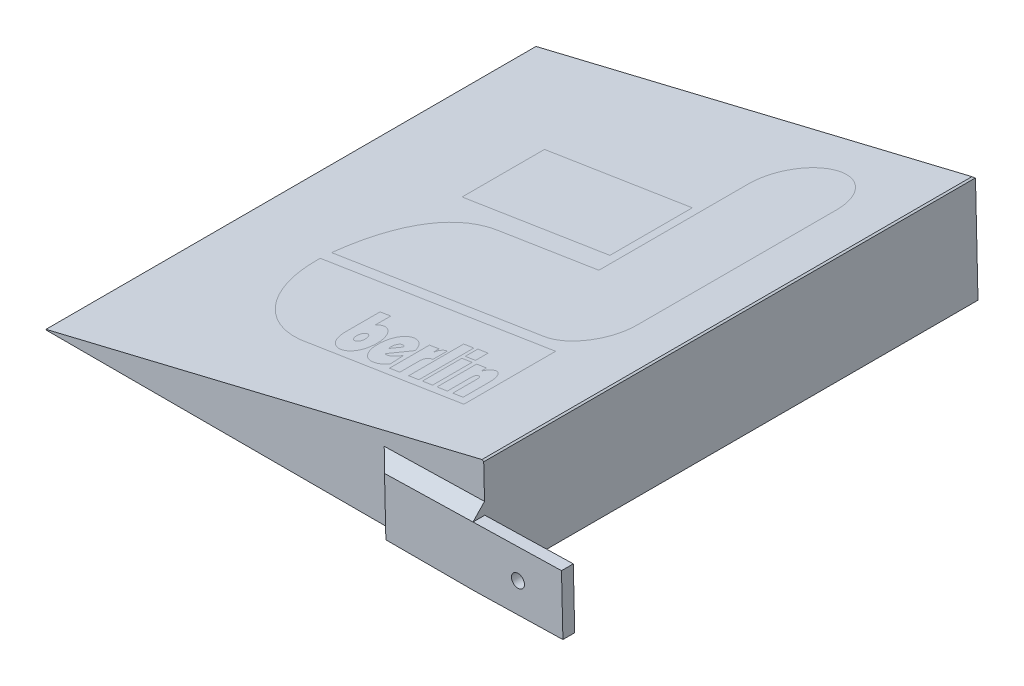
from build123d import *
from OCP.BRepFilletAPI import BRepFilletAPI_MakeChamfer

# Parameters (mm, degrees)
BOSS_EXTRUDE1_DEPTH   = 166.66666666666666
CUT_EXTRUDE1_DEPTH    = 160.666666667
BOSS_EXTRUDE2_DEPTH   = 4
SKETCH9_R             = 2.1999999999999833
CUT_EXTRUDE3_DEPTH    = 673.8557295952264
SKETCH10_R            = 2.1999999999999833
CUT_EXTRUDE4_DEPTH    = 3
CHAMFER3_SIZE         = 0.6
CHAMFER3_SIZE2        = 0.5047874406768073
CHAMFER4_SIZE         = 1
CHAMFER4_SIZE2        = 0.8287182147663876
CUT_EXTRUDE5_DEPTH    = 0.6
BOSS_EXTRUDE4_DEPTH   = 0.6
BOSS_EXTRUDE4_2_DEPTH = 0.6
BOSS_EXTRUDE4_3_DEPTH = 0.6
BOSS_EXTRUDE4_4_DEPTH = 0.6
BOSS_EXTRUDE4_5_DEPTH = 0.6
CHAMFER8_SIZE         = 4
CHAMFER9_SIZE         = 4


with BuildPart() as part:
    # Sketch4 → Boss-Extrude1 (new body)
    with BuildSketch(Plane.XY):
        Polygon((-500.7204776760873, 35.989612544106855), (-649.8557297792629, -1.837e-14), (-499.8557297792629, -6.121e-14), align=None)
    extrude(amount=-BOSS_EXTRUDE1_DEPTH)

    # Sketch6 → Cut-Extrude1 (cut)
    with BuildSketch(Plane.XY.offset(-3)):
        Polygon((-504.85717289786834, -1.837e-14), (-505.570212772658, 29.675734299461347), (-585.1090138943516, 10.481274275937695), (-584.8571728978683, -1.837e-14), align=None)
    extrude(amount=-CUT_EXTRUDE1_DEPTH, mode=Mode.SUBTRACT)

    # Sketch8 → Boss-Extrude2 (add)
    with BuildSketch(Plane.XY):
        Polygon((-500.3361452774986, 19.994229191170454), (-470.34480149074295, 20.714852438524037), (-469.86438599250715, 0.720623247353527), (-499.8557297792629, -6.121e-14), (-529.8643884908956, -2.204e-14), (-530.3274890642546, 19.273605943816776), align=None)
    extrude(amount=BOSS_EXTRUDE2_DEPTH)

    # Sketch9 → Cut-Extrude3 (cut, through all)
    with BuildSketch(Plane.XY.offset(4)):
        with Locations((-485.1002656350029, 10.357426219261987)):
            Circle(SKETCH9_R)
    extrude(amount=-CUT_EXTRUDE3_DEPTH, mode=Mode.SUBTRACT)

    # Sketch10 → Cut-Extrude4 (cut)
    with BuildSketch(Plane(origin=(0, 0, -166.66666666666666), x_dir=(-1, 0, 0), z_dir=(0, 0, -1))):
        with Locations((513.1478143821638, 11.99999999999998)):
            Circle(SKETCH10_R)
        with Locations((527.1478143821638, 11.99999999999998)):
            Circle(SKETCH10_R)
    extrude(amount=-CUT_EXTRUDE4_DEPTH, mode=Mode.SUBTRACT)

    # Chamfer3: one chamfer whose edges measure the first distance from different faces: ONE call of the kernel's chamfer builder (chamfer() names one face for all edges)
    chamfer3_edges_1 = [part.edges().sort_by_distance(p)[0] for p in [
        (-500.7204776760873, 35.989612544106855, -83.33333333333333),
    ]]
    chamfer3_side_1 = [part.faces().sort_by_distance(p)[0] for p in [
        (-575.2881037276751, 17.994806272053417, -83.33333333333333),
    ]]
    chamfer3_edges_2 = [part.edges().sort_by_distance(p)[0] for p in [
        (-575.2881037276751, 17.994806272053417, -166.66666666666666),
    ]]
    chamfer3 = BRepFilletAPI_MakeChamfer(part.part.solid().wrapped)
    for e in chamfer3_edges_1:
        chamfer3.Add(CHAMFER3_SIZE, CHAMFER3_SIZE2, e.wrapped, chamfer3_side_1[0].wrapped)  # the first distance lies on this face
    for e in chamfer3_edges_2:
        chamfer3.Add(CHAMFER3_SIZE, e.wrapped)
    add(Compound.cast(chamfer3.Shape()), mode=Mode.REPLACE)

    # Chamfer4
    chamfer4_edges = [part.edges().sort_by_distance(p)[0] for p in [
        (-649.8557297792629, -1.837e-14, -83.03333333333336),
    ]]
    chamfer4_side = [part.faces().sort_by_distance(p)[0] for p in [
        (-605.6991208479849, -3.098e-14, -82.49305945140193),
    ]]
    chamfer(chamfer4_edges, length=CHAMFER4_SIZE, length2=CHAMFER4_SIZE2, reference=chamfer4_side[0])

    # Sketch14 → Cut-Extrude5 (cut)
    # profile 1 of 5: a face of its own
    with BuildSketch(Plane(origin=(-35.76251210347527, 148.19418385953085, 0), x_dir=(0.9720949213663694, 0.23458785956164097, 0), z_dir=(-0.23458785956164097, 0.9720949213663694, 0))):
        with BuildLine():
            Line((-505.061663315021, 50.39379157667111), (-505.061663315021, 19.301317366944446))
            Line((-505.061663315021, 19.301317366944446), (-564.8750098447946, 25.06229462373534))
            add(Edge.make_bspline(
                [(-564.8750098447946, 25.06229462373534), (-582.2659602264854, 25.789617760691975), (-596.1427141132093, 40.12244935888303), (-596.1427141132093, 57.69583008851142)],
                knots=[0, 0, 0, 0, 1, 1, 1, 1], degree=3))
            Line((-596.1427141132093, 57.69583008851142), (-596.1331123463265, 59.16727979977476))
            Line((-596.1331123463265, 59.16727979977476), (-505.061663315021, 50.39379157667111))
        make_face()
        with BuildLine():
            Line((-536.5021970853022, 24.666227149577168), (-532.5391245493352, 24.284562555946742))
            Line((-532.5391245493352, 24.284562555946742), (-532.5391245493352, 30.693649639025057))
            add(Edge.make_bspline(
                [(-532.5391245493352, 30.693649639025057), (-532.5391245493352, 32.484353610193594), (-531.6845797276994, 33.22127851403342), (-530.6644066142587, 33.12046157318166)],
                knots=[0, 0, 0, 0, 1, 1, 1, 1], degree=3))
            add(Edge.make_bspline(
                [(-530.6644066142587, 33.12046157318166), (-530.3571546780588, 33.091656272532305), (-530.1939269430759, 33.07725385241064), (-530.0306992080925, 33.03404659204564)],
                knots=[0, 0, 0, 0, 1, 1, 1, 1], degree=3))
            Line((-530.0306992080925, 33.03404659204564), (-530.0114956743266, 37.97648507750517))
            add(Edge.make_bspline(
                [(-530.0114956743266, 37.97648507750517), (-531.4997483625339, 38.11810918230565), (-532.4383076084831, 37.337977018100794), (-532.7431594482666, 35.70329957185441)],
                knots=[0, 0, 0, 0, 1, 1, 1, 1], degree=3))
            Line((-532.7431594482666, 35.70329957185441), (-532.7839661518093, 35.7057001286767))
            Line((-532.7839661518093, 35.7057001286767), (-532.7839661518093, 37.8756681366534))
            Line((-532.7839661518093, 37.8756681366534), (-536.5021970853022, 38.190121282914035))
            Line((-536.5021970853022, 38.190121282914035), (-536.5021970853022, 24.666227149577168))
        make_face(mode=Mode.SUBTRACT)
        Polygon((-525.1530716131812, 23.57404193552802), (-525.1530716131812, 42.19159996560199), (-529.0849387520827, 42.57326501963842), (-529.0849387520827, 23.95330643274218), align=None, mode=Mode.SUBTRACT)
        Polygon((-519.848171607451, 37.61162346081864), (-519.848171607451, 41.85794374598112), (-523.8088435865964, 42.26361252661638), (-523.8088435865964, 38.01249112780933), align=None, mode=Mode.SUBTRACT)
        Polygon((-519.848171607451, 23.060355003980167), (-519.848171607451, 36.45942800946049), (-523.8088435865964, 36.86029567645114), (-523.8088435865964, 23.46362322779315), align=None, mode=Mode.SUBTRACT)
        with BuildLine():
            Line((-561.0823667142765, 45.33373317341588), (-561.0823667142765, 33.89099197050339))
            add(Edge.make_bspline(
                [(-561.0823667142765, 33.89099197050339), (-561.0823667142765, 29.51504990424581), (-558.5835426795118, 26.644162582327517), (-555.0573443212454, 26.320107669183795)],
                knots=[0, 0, 0, 0, 1, 1, 1, 1], degree=3))
            add(Edge.make_bspline(
                [(-555.0573443212454, 26.320107669183795), (-552.0256302815721, 26.03926001640506), (-549.2651621277947, 28.3196471925226), (-549.2651621277947, 32.92602844113303)],
                knots=[0, 0, 0, 0, 1, 1, 1, 1], degree=3))
            add(Edge.make_bspline(
                [(-549.2651621277947, 32.92602844113303), (-549.2651621277947, 36.35861060820275), (-551.4519331127152, 40.01443074756445), (-554.4884478056268, 40.29767895716544)],
                knots=[0, 0, 0, 0, 1, 1, 1, 1], degree=3))
            add(Edge.make_bspline(
                [(-554.4884478056268, 40.29767895716544), (-555.6334420469241, 40.40329701166174), (-556.1831354891823, 40.12244935888303), (-556.9680687670318, 39.68317462435989)],
                knots=[0, 0, 0, 0, 1, 1, 1, 1], degree=3))
            Line((-556.9680687670318, 39.68317462435989), (-556.9680687670318, 45.00007649338903))
            Line((-556.9680687670318, 45.00007649338903), (-561.0823667142765, 45.33373317341588))
        make_face(mode=Mode.SUBTRACT)
        with BuildLine():
            Line((-543.2761457850672, 29.78389523331914), (-537.5895811857072, 34.43348420270057))
            add(Edge.make_bspline(
                [(-537.5895811857072, 34.43348420270057), (-538.499335591413, 37.10513727892565), (-540.4340637637982, 38.972654003941166), (-542.9592920819846, 39.20549374311628)],
                knots=[0, 0, 0, 0, 1, 1, 1, 1], degree=3))
            add(Edge.make_bspline(
                [(-542.9592920819846, 39.20549374311628), (-546.0990247329762, 39.49834325919438), (-548.6890644021155, 37.02112285461189), (-548.6890644021155, 32.43874579300628)],
                knots=[0, 0, 0, 0, 1, 1, 1, 1], degree=3))
            add(Edge.make_bspline(
                [(-548.6890644021155, 32.43874579300628), (-548.6890644021155, 28.749319699756665), (-546.2502506046594, 25.479965267669936), (-542.8104672275292, 25.158310911348472)],
                knots=[0, 0, 0, 0, 1, 1, 1, 1], degree=3))
            add(Edge.make_bspline(
                [(-542.8104672275292, 25.158310911348472), (-540.7293138366985, 24.966278336122166), (-539.7283442570239, 25.33113995280864), (-538.00965284687, 26.375317253254213)],
                knots=[0, 0, 0, 0, 1, 1, 1, 1], degree=3))
            Line((-538.00965284687, 26.375317253254213), (-538.328906646369, 31.341759465312528))
            add(Edge.make_bspline(
                [(-538.328906646369, 31.341759465312528), (-539.161848298228, 30.103149493224333), (-540.9405499456911, 29.337419749141112), (-542.085544186989, 29.44543790005373)],
                knots=[0, 0, 0, 0, 1, 1, 1, 1], degree=3))
            add(Edge.make_bspline(
                [(-542.085544186989, 29.44543790005373), (-542.4696093374413, 29.481443950357892), (-542.9784956157505, 29.579860794793333), (-543.2761457850672, 29.78389523331914)],
                knots=[0, 0, 0, 0, 1, 1, 1, 1], degree=3))
        make_face(mode=Mode.SUBTRACT)
        with BuildLine():
            Line((-518.1270801008808, 36.33460642119796), (-518.1270801008808, 22.916330342357405))
            Line((-518.1270801008808, 22.916330342357405), (-514.0967961175435, 22.501059794839033))
            Line((-514.0967961175435, 22.501059794839033), (-514.0967961175435, 30.41520254306865))
            add(Edge.make_bspline(
                [(-514.0967961175435, 30.41520254306865), (-514.0967961175435, 31.032106972290475), (-513.9023634459008, 32.0450788756704), (-513.079023560925, 32.0450788756704)],
                knots=[0, 0, 0, 0, 1, 1, 1, 1], degree=3))
            add(Edge.make_bspline(
                [(-513.079023560925, 32.0450788756704), (-512.2460823694718, 32.0450788756704), (-512.02284439718, 31.195334707273474), (-512.02284439718, 30.65764358872089)],
                knots=[0, 0, 0, 0, 1, 1, 1, 1], degree=3))
            Line((-512.02284439718, 30.65764358872089), (-512.02284439718, 22.30902721961267))
            Line((-512.02284439718, 22.30902721961267), (-508.0213657144919, 21.92496206916003))
            Line((-508.0213657144919, 21.92496206916003), (-508.0213657144919, 30.784865273399678))
            add(Edge.make_bspline(
                [(-508.0213657144919, 30.784865273399678), (-508.0213657144919, 33.370103828894706), (-509.0055327776286, 35.76330980916341), (-511.10348822459093, 35.95534238438977)],
                knots=[0, 0, 0, 0, 1, 1, 1, 1], degree=3))
            add(Edge.make_bspline(
                [(-511.10348822459093, 35.95534238438977), (-512.121261241615, 36.046557558358444), (-513.3526700036427, 35.45125675931909), (-514.1808105418571, 34.16943952686577)],
                knots=[0, 0, 0, 0, 1, 1, 1, 1], degree=3))
            Line((-514.1808105418571, 34.16943952686577), (-514.2624244093489, 34.17664073692664))
            Line((-514.2624244093489, 34.17664073692664), (-514.2624244093489, 35.94334006068441))
            Line((-514.2624244093489, 35.94334006068441), (-518.1270801008808, 36.33460642119796))
        make_face(mode=Mode.SUBTRACT)
    # profile 2 of 5: a face of its own
    with BuildSketch(Plane(origin=(-35.76251210347527, 148.19418385953085, 0), x_dir=(0.9720949213663694, 0.23458785956164097, 0), z_dir=(-0.23458785956164097, 0.9720949213663694, 0))):
        with BuildLine():
            Line((-541.7062796897743, 34.476691463065585), (-544.5483617110434, 32.15789814022756))
            add(Edge.make_bspline(
                [(-544.5483617110434, 32.15789814022756), (-544.6347766921795, 32.39553853264125), (-544.7211912129093, 32.55636571080198), (-544.7211912129093, 33.12046157318166)],
                knots=[0, 0, 0, 0, 1, 1, 1, 1], degree=3))
            add(Edge.make_bspline(
                [(-544.7211912129093, 33.12046157318166), (-544.7211912129093, 34.27265702453981), (-544.020272359374, 35.35764102852817), (-543.0024998027554, 35.264024837331306)],
                knots=[0, 0, 0, 0, 1, 1, 1, 1], degree=3))
            add(Edge.make_bspline(
                [(-543.0024998027554, 35.264024837331306), (-542.4696093374413, 35.21361636690543), (-542.0447370230397, 35.04798853550612), (-541.7062796897743, 34.476691463065585)],
                knots=[0, 0, 0, 0, 1, 1, 1, 1], degree=3))
        make_face()
    # profile 3 of 5: a face of its own
    with BuildSketch(Plane(origin=(-35.76251210347527, 148.19418385953085, 0), x_dir=(0.9720949213663694, 0.23458785956164097, 0), z_dir=(-0.23458785956164097, 0.9720949213663694, 0))):
        with BuildLine():
            Line((-513.7103308706745, 54.78653661987265), (-595.8306610633649, 62.68147583433599))
            add(Edge.make_bspline(
                [(-595.8306610633649, 62.68147583433599), (-592.7581398597437, 80.2524564675481), (-583.6485943997906, 92.08886458779642), (-566.6225065555979, 90.4997949587374)],
                knots=[0, 0, 0, 0, 1, 1, 1, 1], degree=3))
            Line((-566.6225065555979, 90.4997949587374), (-566.5865000448878, 90.5093962652145))
            Line((-566.5865000448878, 90.5093962652145), (-527.3710479951673, 86.73595620805712))
            Line((-527.3710479951673, 86.73595620805712), (-527.3710479951673, 137.6461922732255))
            add(Edge.make_bspline(
                [(-527.3710479951673, 137.6461922732255), (-527.3086372010359, 146.03561580628238), (-520.4866801272614, 152.81916627293035), (-512.0804540776669, 152.81916627293035)],
                knots=[0, 0, 0, 0, 1, 1, 1, 1], degree=3))
            add(Edge.make_bspline(
                [(-512.0804540776669, 152.81916627293035), (-503.67662858489405, 152.81916627293035), (-496.8546715111194, 146.03561580628238), (-496.78505950692755, 137.6461922732255)],
                knots=[0, 0, 0, 0, 1, 1, 1, 1], degree=3))
            Line((-496.78505950692755, 137.6461922732255), (-496.78505950692755, 69.95470950593295))
            add(Edge.make_bspline(
                [(-496.78505950692755, 69.95470950593295), (-496.8090636939323, 61.52447972973926), (-503.6454231878282, 54.70012209914257), (-512.0804540776669, 54.70012209914257)],
                knots=[0, 0, 0, 0, 1, 1, 1, 1], degree=3))
            add(Edge.make_bspline(
                [(-512.0804540776669, 54.70012209914257), (-512.6301475199247, 54.70012209914257), (-513.1750398485382, 54.73132749620821), (-513.7103308706745, 54.78653661987265)],
                knots=[0, 0, 0, 0, 1, 1, 1, 1], degree=3))
        make_face()
    # profile 4 of 5: a face of its own
    with BuildSketch(Plane(origin=(-35.76251210347527, 148.19418385953085, 0), x_dir=(0.9720949213663694, 0.23458785956164097, 0), z_dir=(-0.23458785956164097, 0.9720949213663694, 0))):
        Polygon((-530.7580223450494, 121.69548666613805), (-530.7580223450494, 93.76674883400182), (-587.9501242690233, 99.27568373866332), (-587.9501242690233, 127.20442111039354), align=None)
    # profile 5 of 5: a face of its own
    with BuildSketch(Plane(origin=(-35.76251210347527, 148.19418385953085, 0), x_dir=(0.9720949213663694, 0.23458785956164097, 0), z_dir=(-0.23458785956164097, 0.9720949213663694, 0))):
        with BuildLine():
            add(Edge.make_bspline(
                [(-556.9680687670318, 33.51412803011148), (-556.9680687670318, 34.637518641226315), (-556.3127572702774, 35.552073700170816), (-555.3141882474252, 35.45845796937993)],
                knots=[0, 0, 0, 0, 1, 1, 1, 1], degree=3))
            add(Edge.make_bspline(
                [(-555.3141882474252, 35.45845796937993), (-554.3396229511716, 35.36964289182759), (-553.6795108011788, 34.3350673582651), (-553.6795108011788, 33.20687609391173)],
                knots=[0, 0, 0, 0, 1, 1, 1, 1], degree=3))
            add(Edge.make_bspline(
                [(-553.6795108011788, 33.20687609391173), (-553.6795108011788, 32.081084925974636), (-554.3396229511716, 31.168930423852416), (-555.3141882474252, 31.260145597821047)],
                knots=[0, 0, 0, 0, 1, 1, 1, 1], degree=3))
            add(Edge.make_bspline(
                [(-555.3141882474252, 31.260145597821047), (-556.3127572702775, 31.35136123219564), (-556.9680687670318, 32.383536208935816), (-556.9680687670318, 33.51412803011148)],
                knots=[0, 0, 0, 0, 1, 1, 1, 1], degree=3))
        make_face()
    extrude(amount=-CUT_EXTRUDE5_DEPTH, mode=Mode.SUBTRACT)

    # Chamfer8
    chamfer8_edges = [part.edges().sort_by_distance(p)[0] for p in [
        (-515.3318171708765, 19.633917567493594, 0),
    ]]
    chamfer(chamfer8_edges, length=CHAMFER8_SIZE - 0.0001)  # a hair under: the kernel refuses the full size

    # Chamfer9
    chamfer9_edges = [part.edges().sort_by_distance(p)[0] for p in [
        (-530.1439791263599, 11.636175905452475, 0),
    ]]
    chamfer(chamfer9_edges, length=CHAMFER9_SIZE - 0.0001)  # a hair under: the kernel refuses the full size


with BuildPart() as body_2:
    # Sketch14<4> → Boss-Extrude4 (new body)
    with BuildSketch(Plane(origin=(-35.76251210347527, 148.19418385953085, 0), x_dir=(0.9720949213663694, 0.23458785956164097, 0), z_dir=(-0.23458785956164097, 0.9720949213663694, 0))):
        with BuildLine():
            Line((-505.061663315021, 50.39379157667111), (-505.061663315021, 19.301317366944446))
            Line((-505.061663315021, 19.301317366944446), (-564.8750098447946, 25.06229462373534))
            add(Edge.make_bspline(
                [(-564.8750098447946, 25.06229462373534), (-582.2659602264854, 25.789617760691975), (-596.1427141132093, 40.12244935888303), (-596.1427141132093, 57.69583008851142)],
                knots=[0, 0, 0, 0, 1, 1, 1, 1], degree=3))
            Line((-596.1427141132093, 57.69583008851142), (-596.1331123463265, 59.16727979977476))
            Line((-596.1331123463265, 59.16727979977476), (-505.061663315021, 50.39379157667111))
        make_face()
        with BuildLine():
            Line((-536.5021970853022, 24.666227149577168), (-532.5391245493352, 24.284562555946742))
            Line((-532.5391245493352, 24.284562555946742), (-532.5391245493352, 30.693649639025057))
            add(Edge.make_bspline(
                [(-532.5391245493352, 30.693649639025057), (-532.5391245493352, 32.484353610193594), (-531.6845797276994, 33.22127851403342), (-530.6644066142587, 33.12046157318166)],
                knots=[0, 0, 0, 0, 1, 1, 1, 1], degree=3))
            add(Edge.make_bspline(
                [(-530.6644066142587, 33.12046157318166), (-530.3571546780588, 33.091656272532305), (-530.1939269430759, 33.07725385241064), (-530.0306992080925, 33.03404659204564)],
                knots=[0, 0, 0, 0, 1, 1, 1, 1], degree=3))
            Line((-530.0306992080925, 33.03404659204564), (-530.0114956743266, 37.97648507750517))
            add(Edge.make_bspline(
                [(-530.0114956743266, 37.97648507750517), (-531.4997483625339, 38.11810918230565), (-532.4383076084831, 37.337977018100794), (-532.7431594482666, 35.70329957185441)],
                knots=[0, 0, 0, 0, 1, 1, 1, 1], degree=3))
            Line((-532.7431594482666, 35.70329957185441), (-532.7839661518093, 35.7057001286767))
            Line((-532.7839661518093, 35.7057001286767), (-532.7839661518093, 37.8756681366534))
            Line((-532.7839661518093, 37.8756681366534), (-536.5021970853022, 38.190121282914035))
            Line((-536.5021970853022, 38.190121282914035), (-536.5021970853022, 24.666227149577168))
        make_face(mode=Mode.SUBTRACT)
        Polygon((-525.1530716131812, 23.57404193552802), (-525.1530716131812, 42.19159996560199), (-529.0849387520827, 42.57326501963842), (-529.0849387520827, 23.95330643274218), align=None, mode=Mode.SUBTRACT)
        Polygon((-519.848171607451, 37.61162346081864), (-519.848171607451, 41.85794374598112), (-523.8088435865964, 42.26361252661638), (-523.8088435865964, 38.01249112780933), align=None, mode=Mode.SUBTRACT)
        Polygon((-519.848171607451, 23.060355003980167), (-519.848171607451, 36.45942800946049), (-523.8088435865964, 36.86029567645114), (-523.8088435865964, 23.46362322779315), align=None, mode=Mode.SUBTRACT)
        with BuildLine():
            Line((-561.0823667142765, 45.33373317341588), (-561.0823667142765, 33.89099197050339))
            add(Edge.make_bspline(
                [(-561.0823667142765, 33.89099197050339), (-561.0823667142765, 29.51504990424581), (-558.5835426795118, 26.644162582327517), (-555.0573443212454, 26.320107669183795)],
                knots=[0, 0, 0, 0, 1, 1, 1, 1], degree=3))
            add(Edge.make_bspline(
                [(-555.0573443212454, 26.320107669183795), (-552.0256302815721, 26.03926001640506), (-549.2651621277947, 28.3196471925226), (-549.2651621277947, 32.92602844113303)],
                knots=[0, 0, 0, 0, 1, 1, 1, 1], degree=3))
            add(Edge.make_bspline(
                [(-549.2651621277947, 32.92602844113303), (-549.2651621277947, 36.35861060820275), (-551.4519331127152, 40.01443074756445), (-554.4884478056268, 40.29767895716544)],
                knots=[0, 0, 0, 0, 1, 1, 1, 1], degree=3))
            add(Edge.make_bspline(
                [(-554.4884478056268, 40.29767895716544), (-555.6334420469241, 40.40329701166174), (-556.1831354891823, 40.12244935888303), (-556.9680687670318, 39.68317462435989)],
                knots=[0, 0, 0, 0, 1, 1, 1, 1], degree=3))
            Line((-556.9680687670318, 39.68317462435989), (-556.9680687670318, 45.00007649338903))
            Line((-556.9680687670318, 45.00007649338903), (-561.0823667142765, 45.33373317341588))
        make_face(mode=Mode.SUBTRACT)
        with BuildLine():
            Line((-543.2761457850672, 29.78389523331914), (-537.5895811857072, 34.43348420270057))
            add(Edge.make_bspline(
                [(-537.5895811857072, 34.43348420270057), (-538.499335591413, 37.10513727892565), (-540.4340637637982, 38.972654003941166), (-542.9592920819846, 39.20549374311628)],
                knots=[0, 0, 0, 0, 1, 1, 1, 1], degree=3))
            add(Edge.make_bspline(
                [(-542.9592920819846, 39.20549374311628), (-546.0990247329762, 39.49834325919438), (-548.6890644021155, 37.02112285461189), (-548.6890644021155, 32.43874579300628)],
                knots=[0, 0, 0, 0, 1, 1, 1, 1], degree=3))
            add(Edge.make_bspline(
                [(-548.6890644021155, 32.43874579300628), (-548.6890644021155, 28.749319699756665), (-546.2502506046594, 25.479965267669936), (-542.8104672275292, 25.158310911348472)],
                knots=[0, 0, 0, 0, 1, 1, 1, 1], degree=3))
            add(Edge.make_bspline(
                [(-542.8104672275292, 25.158310911348472), (-540.7293138366985, 24.966278336122166), (-539.7283442570239, 25.33113995280864), (-538.00965284687, 26.375317253254213)],
                knots=[0, 0, 0, 0, 1, 1, 1, 1], degree=3))
            Line((-538.00965284687, 26.375317253254213), (-538.328906646369, 31.341759465312528))
            add(Edge.make_bspline(
                [(-538.328906646369, 31.341759465312528), (-539.161848298228, 30.103149493224333), (-540.9405499456911, 29.337419749141112), (-542.085544186989, 29.44543790005373)],
                knots=[0, 0, 0, 0, 1, 1, 1, 1], degree=3))
            add(Edge.make_bspline(
                [(-542.085544186989, 29.44543790005373), (-542.4696093374413, 29.481443950357892), (-542.9784956157505, 29.579860794793333), (-543.2761457850672, 29.78389523331914)],
                knots=[0, 0, 0, 0, 1, 1, 1, 1], degree=3))
        make_face(mode=Mode.SUBTRACT)
        with BuildLine():
            Line((-518.1270801008808, 36.33460642119796), (-518.1270801008808, 22.916330342357405))
            Line((-518.1270801008808, 22.916330342357405), (-514.0967961175435, 22.501059794839033))
            Line((-514.0967961175435, 22.501059794839033), (-514.0967961175435, 30.41520254306865))
            add(Edge.make_bspline(
                [(-514.0967961175435, 30.41520254306865), (-514.0967961175435, 31.032106972290475), (-513.9023634459008, 32.0450788756704), (-513.079023560925, 32.0450788756704)],
                knots=[0, 0, 0, 0, 1, 1, 1, 1], degree=3))
            add(Edge.make_bspline(
                [(-513.079023560925, 32.0450788756704), (-512.2460823694718, 32.0450788756704), (-512.02284439718, 31.195334707273474), (-512.02284439718, 30.65764358872089)],
                knots=[0, 0, 0, 0, 1, 1, 1, 1], degree=3))
            Line((-512.02284439718, 30.65764358872089), (-512.02284439718, 22.30902721961267))
            Line((-512.02284439718, 22.30902721961267), (-508.0213657144919, 21.92496206916003))
            Line((-508.0213657144919, 21.92496206916003), (-508.0213657144919, 30.784865273399678))
            add(Edge.make_bspline(
                [(-508.0213657144919, 30.784865273399678), (-508.0213657144919, 33.370103828894706), (-509.0055327776286, 35.76330980916341), (-511.10348822459093, 35.95534238438977)],
                knots=[0, 0, 0, 0, 1, 1, 1, 1], degree=3))
            add(Edge.make_bspline(
                [(-511.10348822459093, 35.95534238438977), (-512.121261241615, 36.046557558358444), (-513.3526700036427, 35.45125675931909), (-514.1808105418571, 34.16943952686577)],
                knots=[0, 0, 0, 0, 1, 1, 1, 1], degree=3))
            Line((-514.1808105418571, 34.16943952686577), (-514.2624244093489, 34.17664073692664))
            Line((-514.2624244093489, 34.17664073692664), (-514.2624244093489, 35.94334006068441))
            Line((-514.2624244093489, 35.94334006068441), (-518.1270801008808, 36.33460642119796))
        make_face(mode=Mode.SUBTRACT)
    extrude(amount=-BOSS_EXTRUDE4_DEPTH)


with BuildPart() as body_3:
    # Sketch14<4> → Boss-Extrude4 2 (new body)
    with BuildSketch(Plane(origin=(-35.76251210347527, 148.19418385953085, 0), x_dir=(0.9720949213663694, 0.23458785956164097, 0), z_dir=(-0.23458785956164097, 0.9720949213663694, 0))):
        with BuildLine():
            Line((-541.7062796897743, 34.476691463065585), (-544.5483617110434, 32.15789814022756))
            add(Edge.make_bspline(
                [(-544.5483617110434, 32.15789814022756), (-544.6347766921795, 32.39553853264125), (-544.7211912129093, 32.55636571080198), (-544.7211912129093, 33.12046157318166)],
                knots=[0, 0, 0, 0, 1, 1, 1, 1], degree=3))
            add(Edge.make_bspline(
                [(-544.7211912129093, 33.12046157318166), (-544.7211912129093, 34.27265702453981), (-544.020272359374, 35.35764102852817), (-543.0024998027554, 35.264024837331306)],
                knots=[0, 0, 0, 0, 1, 1, 1, 1], degree=3))
            add(Edge.make_bspline(
                [(-543.0024998027554, 35.264024837331306), (-542.4696093374413, 35.21361636690543), (-542.0447370230397, 35.04798853550612), (-541.7062796897743, 34.476691463065585)],
                knots=[0, 0, 0, 0, 1, 1, 1, 1], degree=3))
        make_face()
    extrude(amount=-BOSS_EXTRUDE4_2_DEPTH)


with BuildPart() as body_4:
    # Sketch14<4> → Boss-Extrude4 3 (new body)
    with BuildSketch(Plane(origin=(-35.76251210347527, 148.19418385953085, 0), x_dir=(0.9720949213663694, 0.23458785956164097, 0), z_dir=(-0.23458785956164097, 0.9720949213663694, 0))):
        with BuildLine():
            Line((-513.7103308706745, 54.78653661987265), (-595.8306610633649, 62.68147583433599))
            add(Edge.make_bspline(
                [(-595.8306610633649, 62.68147583433599), (-592.7581398597437, 80.2524564675481), (-583.6485943997906, 92.08886458779642), (-566.6225065555979, 90.4997949587374)],
                knots=[0, 0, 0, 0, 1, 1, 1, 1], degree=3))
            Line((-566.6225065555979, 90.4997949587374), (-566.5865000448878, 90.5093962652145))
            Line((-566.5865000448878, 90.5093962652145), (-527.3710479951673, 86.73595620805712))
            Line((-527.3710479951673, 86.73595620805712), (-527.3710479951673, 137.6461922732255))
            add(Edge.make_bspline(
                [(-527.3710479951673, 137.6461922732255), (-527.3086372010359, 146.03561580628238), (-520.4866801272614, 152.81916627293035), (-512.0804540776669, 152.81916627293035)],
                knots=[0, 0, 0, 0, 1, 1, 1, 1], degree=3))
            add(Edge.make_bspline(
                [(-512.0804540776669, 152.81916627293035), (-503.67662858489405, 152.81916627293035), (-496.8546715111194, 146.03561580628238), (-496.78505950692755, 137.6461922732255)],
                knots=[0, 0, 0, 0, 1, 1, 1, 1], degree=3))
            Line((-496.78505950692755, 137.6461922732255), (-496.78505950692755, 69.95470950593295))
            add(Edge.make_bspline(
                [(-496.78505950692755, 69.95470950593295), (-496.8090636939323, 61.52447972973926), (-503.6454231878282, 54.70012209914257), (-512.0804540776669, 54.70012209914257)],
                knots=[0, 0, 0, 0, 1, 1, 1, 1], degree=3))
            add(Edge.make_bspline(
                [(-512.0804540776669, 54.70012209914257), (-512.6301475199247, 54.70012209914257), (-513.1750398485382, 54.73132749620821), (-513.7103308706745, 54.78653661987265)],
                knots=[0, 0, 0, 0, 1, 1, 1, 1], degree=3))
        make_face()
    extrude(amount=-BOSS_EXTRUDE4_3_DEPTH)


with BuildPart() as body_5:
    # Sketch14<4> → Boss-Extrude4 4 (new body)
    with BuildSketch(Plane(origin=(-35.76251210347527, 148.19418385953085, 0), x_dir=(0.9720949213663694, 0.23458785956164097, 0), z_dir=(-0.23458785956164097, 0.9720949213663694, 0))):
        Polygon((-530.7580223450494, 121.69548666613805), (-530.7580223450494, 93.76674883400182), (-587.9501242690233, 99.27568373866332), (-587.9501242690233, 127.20442111039354), align=None)
    extrude(amount=-BOSS_EXTRUDE4_4_DEPTH)


with BuildPart() as body_6:
    # Sketch14<4> → Boss-Extrude4 5 (new body)
    with BuildSketch(Plane(origin=(-35.76251210347527, 148.19418385953085, 0), x_dir=(0.9720949213663694, 0.23458785956164097, 0), z_dir=(-0.23458785956164097, 0.9720949213663694, 0))):
        with BuildLine():
            add(Edge.make_bspline(
                [(-556.9680687670318, 33.51412803011148), (-556.9680687670318, 34.637518641226315), (-556.3127572702774, 35.552073700170816), (-555.3141882474252, 35.45845796937993)],
                knots=[0, 0, 0, 0, 1, 1, 1, 1], degree=3))
            add(Edge.make_bspline(
                [(-555.3141882474252, 35.45845796937993), (-554.3396229511716, 35.36964289182759), (-553.6795108011788, 34.3350673582651), (-553.6795108011788, 33.20687609391173)],
                knots=[0, 0, 0, 0, 1, 1, 1, 1], degree=3))
            add(Edge.make_bspline(
                [(-553.6795108011788, 33.20687609391173), (-553.6795108011788, 32.081084925974636), (-554.3396229511716, 31.168930423852416), (-555.3141882474252, 31.260145597821047)],
                knots=[0, 0, 0, 0, 1, 1, 1, 1], degree=3))
            add(Edge.make_bspline(
                [(-555.3141882474252, 31.260145597821047), (-556.3127572702775, 31.35136123219564), (-556.9680687670318, 32.383536208935816), (-556.9680687670318, 33.51412803011148)],
                knots=[0, 0, 0, 0, 1, 1, 1, 1], degree=3))
        make_face()
    extrude(amount=-BOSS_EXTRUDE4_5_DEPTH)


solid = Compound([part.part, body_2.part, body_3.part, body_4.part, body_5.part, body_6.part])
